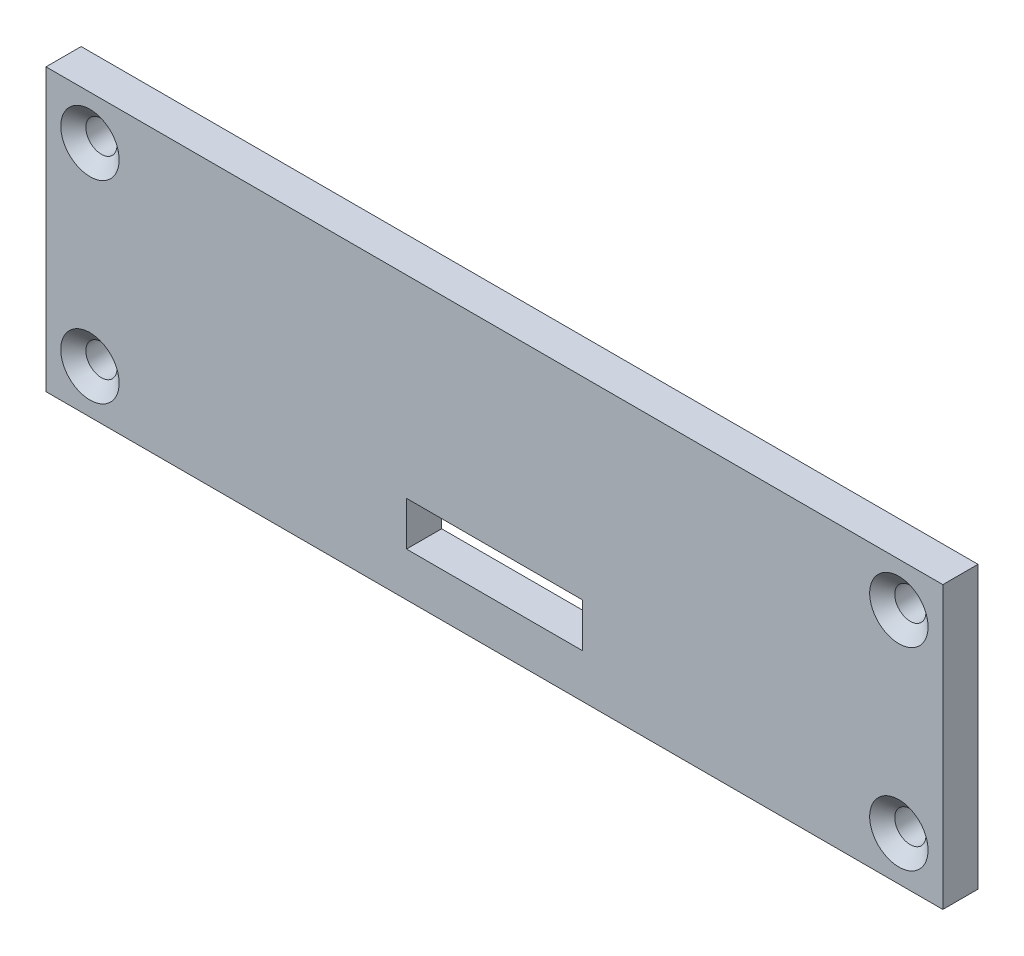
from build123d import *

# Parameters (mm, degrees)
SKETCH1_W                                         = 129.54
SKETCH1_H                                         = 40.64
BOSS_EXTRUDE1_DEPTH                               = 5.08
CSK_FOR_8_FLAT_HEAD_MACHINE_SCREW_100_D           = 4.4958
CSK_FOR_8_FLAT_HEAD_MACHINE_SCREW_100_CSINK_D     = 8.4328
CSK_FOR_8_FLAT_HEAD_MACHINE_SCREW_100_CSINK_ANGLE = 100
SKETCH5_W                                         = 25.4
SKETCH5_H                                         = 6.35
CUT_EXTRUDE1_DEPTH                                = 69.072473879


with BuildPart() as part:
    # Sketch1 → Boss-Extrude1 (new body)
    with BuildSketch(Plane.XY):
        Rectangle(SKETCH1_W, SKETCH1_H)
    extrude(amount=BOSS_EXTRUDE1_DEPTH)

    # CSK for #8 Flat Head Machine Screw (100)1 (through all)
    with Locations(Plane.XY.offset(5.08)):
        with Locations((-58.42, 13.97), (-58.42, -13.97), (58.42, -13.97), (58.42, 13.97)):
            CounterSinkHole(CSK_FOR_8_FLAT_HEAD_MACHINE_SCREW_100_D / 2, CSK_FOR_8_FLAT_HEAD_MACHINE_SCREW_100_CSINK_D / 2, counter_sink_angle=CSK_FOR_8_FLAT_HEAD_MACHINE_SCREW_100_CSINK_ANGLE)

    # Sketch5 → Cut-Extrude1 (cut, through all)
    with BuildSketch(Plane.XY.offset(5.08)):
        with Locations((0, -10.795)):
            Rectangle(SKETCH5_W, SKETCH5_H)
    extrude(amount=-CUT_EXTRUDE1_DEPTH, mode=Mode.SUBTRACT)


solid = part.part
